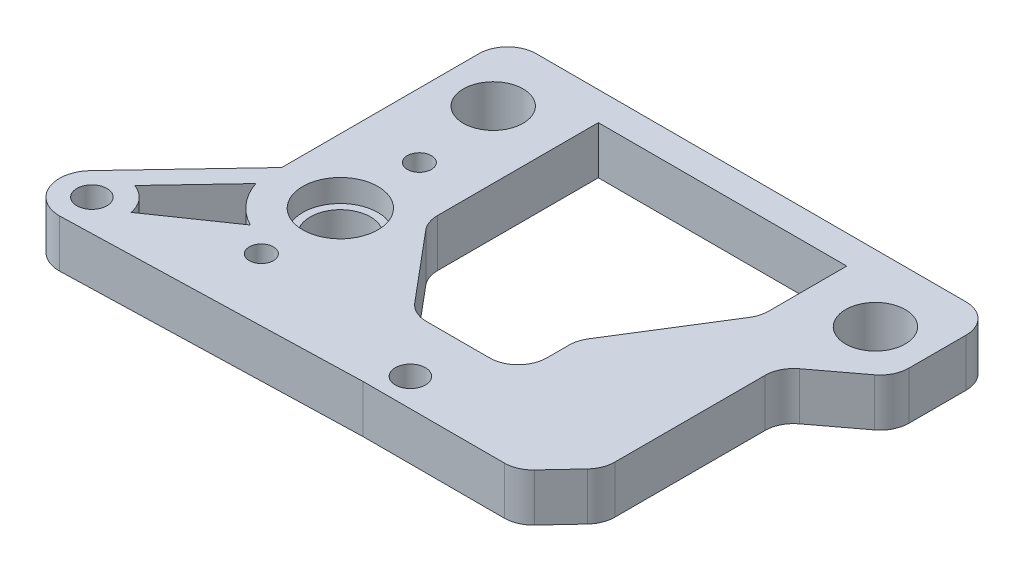
from build123d import *

# Parameters (mm, degrees)
SKETCH4_R           = 2
SKETCH4_R_2         = 5
SKETCH4_R_3         = 1.6
SKETCH4_R_4         = 3.96875
BOSS_EXTRUDE2_DEPTH = 6.35
BOSS_EXTRUDE5_START = -3.35
SKETCH22_R          = 5
SKETCH22_R_2        = 4
BOSS_EXTRUDE5_DEPTH = 3.35


with BuildPart() as part:
    # Sketch4 → Boss-Extrude2 (new body)
    with BuildSketch(Plane(origin=(0, 0, 0), x_dir=(1, 0, 0), z_dir=(0, 1, 0))):
        with BuildLine():
            Line((21.46596982, -18.4375), (40.257702493, -18.4375))
            ThreePointArc((40.257702493, -18.4375), (41.776936446, -18.121498883), (43.044160097, -17.225913752))
            Line((43.044160097, -17.225913752), (46.444939319, -13.579024524))
            ThreePointArc((46.444939319, -13.579024524), (47.203372649, -12.376980446), (47.468481715, -10.980610773))
            Line((47.468481715, -10.980610773), (47.468481715, 8.985116992))
            ThreePointArc((47.468481715, 8.985116992), (47.868781798, 10.685130659), (48.985566477, 12.027918285))
            Line((48.985566477, 12.027918285), (54.680415238, 16.319294633))
            ThreePointArc((54.680415238, 16.319294633), (55.797199918, 17.662082259), (56.1975, 19.362095927))
            Line((56.1975, 19.362095927), (56.1975, 26.9875))
            ThreePointArc((56.1975, 26.9875), (55.081576836, 29.681576836), (52.3875, 30.7975))
            Line((52.3875, 30.7975), (-4.7625, 30.7975))
            ThreePointArc((-4.7625, 30.7975), (-7.456576836, 29.681576836), (-8.5725, 26.9875))
            Line((-8.5725, 26.9875), (-8.5725, 0.781747009))
            Line((-8.5725, 0.781747009), (-20.917416467, -12.27322702))
            ThreePointArc((-20.917416467, -12.27322702), (-21.745832178, -16.948010286), (-17.78, -19.558))
            Line((-17.78, -19.558), (21.46596982, -18.4375))
        make_face()
        with Locations((-17.78, -15.24)):
            Circle(SKETCH4_R, mode=Mode.SUBTRACT)
        with BuildLine():
            Line((-4.038317295, -7.919854381), (-13.417009712, -14.390093684))
            ThreePointArc((-13.417009712, -14.390093684), (-14.405104402, -12.347232345), (-16.272811714, -11.058324681))
            Line((-16.272811714, -11.058324681), (-8.444304622, -2.779535833))
            ThreePointArc((-8.444304622, -2.779535833), (-6.749791195, -5.78553531), (-4.038317295, -7.919854381))
        make_face(mode=Mode.SUBTRACT)
        Circle(SKETCH4_R_2, mode=Mode.SUBTRACT)
        with Locations((24.012521227, -14.703599027)):
            Circle(SKETCH4_R, mode=Mode.SUBTRACT)
        with Locations((0, 10.5)):
            Circle(SKETCH4_R_3, mode=Mode.SUBTRACT)
        with Locations((-1.5875, 21.9075)):
            Circle(SKETCH4_R_4, mode=Mode.SUBTRACT)
        with BuildLine():
            Line((7.3025, 26.9875), (40.3225, 26.9875))
            Line((40.3225, 26.9875), (40.3225, 16.611657969))
            ThreePointArc((40.3225, 16.611657969), (40.174907062, 15.561479644), (39.743563246, 14.592665573))
            Line((39.743563246, 14.592665573), (31.537418469, 1.460088735))
            ThreePointArc((31.537418469, 1.460088735), (31.106074654, 0.491274664), (30.958481715, -0.558903662))
            Line((30.958481715, -0.558903662), (30.958481715, -3.507298313))
            ThreePointArc((30.958481715, -3.507298313), (29.842558552, -6.20137515), (27.148481715, -7.317298313))
            Line((27.148481715, -7.317298313), (18.766481715, -7.317298313))
            ThreePointArc((18.766481715, -7.317298313), (17.156306138, -6.960330982), (15.847852387, -5.956319106))
            Line((15.847852387, -5.956319106), (8.193870672, 3.165341101))
            ThreePointArc((8.193870672, 3.165341101), (7.532271115, 4.311265148), (7.3025, 5.614361894))
            Line((7.3025, 5.614361894), (7.3025, 26.9875))
        make_face(mode=Mode.SUBTRACT)
        with Locations((49.2125, 21.9075)):
            Circle(SKETCH4_R_4, mode=Mode.SUBTRACT)
        with Locations((0, -10.5)):
            Circle(SKETCH4_R_3, mode=Mode.SUBTRACT)
    extrude(amount=-BOSS_EXTRUDE2_DEPTH)

    # Sketch22 → Boss-Extrude5 (add)
    with BuildSketch(Plane.XZ.offset(6.35).offset(BOSS_EXTRUDE5_START)):
        Circle(SKETCH22_R)
        Circle(SKETCH22_R_2, mode=Mode.SUBTRACT)
    extrude(amount=BOSS_EXTRUDE5_DEPTH)


solid = part.part
